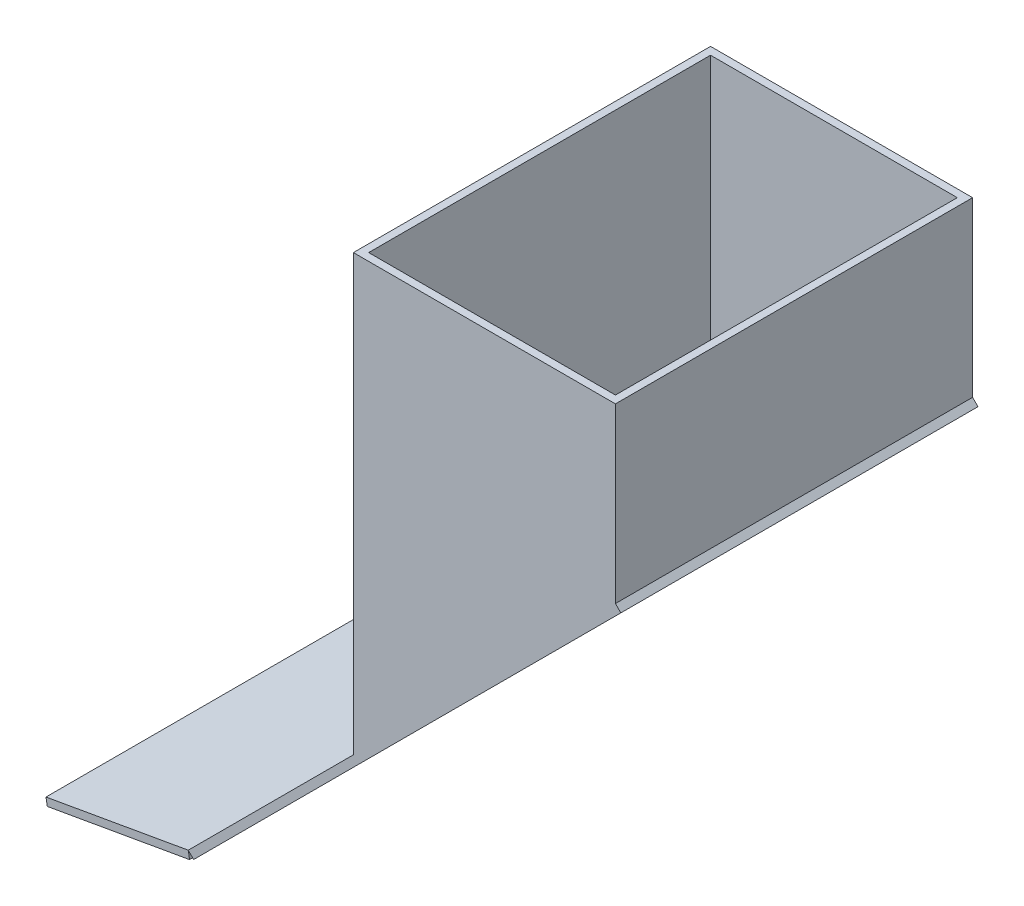
from build123d import *

# Parameters (mm, degrees)
BOSS_EXTRUDE1_REACH             = 773.931
SKETCH1_W                       = 217.7
SKETCH1_H                       = 296.7
SKETCH1_W_2                     = 205
SKETCH1_H_2                     = 284
SKETCH3_W                       = 296.7
SKETCH3_H                       = 501.874292529
BOSS_EXTRUDE2_DEPTH             = 6.35
CUT_EXTRUDE1_REACH              = 581.28
CUT_EXTRUDE1_DIRECTION_2_REACH  = 581.28
BOSS_EXTRUDE3_REACH             = 581.28
BOSS_EXTRUDE3_DIRECTION_2_REACH = 581.28
SKETCH6_W                       = 6.35
SKETCH6_H                       = 20
CUT_EXTRUDE2_DEPTH              = 22.5


with BuildPart() as part:
    # Boss-Extrude1: up to this plane
    boss_extrude1_end = Plane(origin=(126.25, -126.25, 0), z_dir=(-0.7071067811865488, 0.7071067811865464, 0))
    # Sketch1 → Boss-Extrude1 (new, up to the surface)
    with BuildSketch(Plane(origin=(0, 0, 0), x_dir=(1, 0, 0), z_dir=(0, 1, 0)), mode=Mode.PRIVATE) as boss_extrude1_sk1:
        Rectangle(SKETCH1_W, SKETCH1_H)
        Rectangle(SKETCH1_W_2, SKETCH1_H_2, mode=Mode.SUBTRACT)
    boss_extrude1_tool1 = split(extrude(boss_extrude1_sk1.sketch, amount=-BOSS_EXTRUDE1_REACH, mode=Mode.PRIVATE), bisect_by=boss_extrude1_end, keep=Keep.BOTH, mode=Mode.PRIVATE)
    add(boss_extrude1_tool1.solids().sort_by_distance((0, 0, -144.669998))[0])

    # Sketch3 → Boss-Extrude2 (add)
    with BuildSketch(Plane(origin=(126.25, -126.25, 0), x_dir=(0, 0, -1), z_dir=(-0.7071067811865488, 0.7071067811865464, 0))):
        with Locations((0, 275.54446225)):
            Rectangle(SKETCH3_W, SKETCH3_H)
    extrude(amount=-BOSS_EXTRUDE2_DEPTH)

    # Cut-Extrude1: up to this face of the body (flat: up to its plane)
    cut_extrude1_end = Plane(part.part.faces().sort_by_distance((-13.869636964, -133.184818482, -142))[0])
    # Sketch4 → Cut-Extrude1 (cut, up to the picked face)
    with BuildSketch(Plane.XY, mode=Mode.PRIVATE) as cut_extrude1_sk1:
        Polygon((-108.85, -361.35), (-102.5, -355), (-102.5, -293), (-108.85, -293), align=None)
    cut_extrude1_tool1 = split(extrude(cut_extrude1_sk1.sketch, amount=-CUT_EXTRUDE1_REACH, mode=Mode.PRIVATE), bisect_by=cut_extrude1_end, keep=Keep.BOTH, mode=Mode.PRIVATE)
    add(cut_extrude1_tool1.solids().sort_by(Axis((-105.726557, -325.613278, 0), (0, 0, -1)))[0], mode=Mode.SUBTRACT)

    # Cut-Extrude1 direction 2: up to this face of the body (flat: up to its plane)
    cut_extrude1_direction_2_end = Plane(part.part.faces().sort_by_distance((-13.869636964, -133.184818482, 142))[0])
    # Sketch4 → Cut-Extrude1 direction 2 (cut, up to the picked face)
    with BuildSketch(Plane.XY, mode=Mode.PRIVATE) as cut_extrude1_direction_2_sk1:
        Polygon((-108.85, -361.35), (-102.5, -355), (-102.5, -293), (-108.85, -293), align=None)
    cut_extrude1_direction_2_tool1 = split(extrude(cut_extrude1_direction_2_sk1.sketch, amount=CUT_EXTRUDE1_DIRECTION_2_REACH, mode=Mode.PRIVATE), bisect_by=cut_extrude1_direction_2_end, keep=Keep.BOTH, mode=Mode.PRIVATE)
    add(cut_extrude1_direction_2_tool1.solids().sort_by(Axis((-105.726557, -325.613278, 0), (0, 0, 1)))[0], mode=Mode.SUBTRACT)


with BuildPart() as body_2:

    # Boss-Extrude3: up to this face of the body (flat: up to its plane)
    boss_extrude3_end = Plane(part.part.faces().sort_by_distance((-18.419822897, -144.442148087, -148.35))[0])
    # Sketch5 → Boss-Extrude3 (new, up to the picked face)
    with BuildSketch(Plane.XY, mode=Mode.PRIVATE) as boss_extrude3_sk1:
        Polygon((-246.02871555, -498.52871555), (-244.926049622, -504.782244782), (-363.102979983, -525.620026102), (-364.205645912, -519.36649687), align=None)
    boss_extrude3_tool1 = split(extrude(boss_extrude3_sk1.sketch, amount=-BOSS_EXTRUDE3_REACH, mode=Mode.PRIVATE), bisect_by=boss_extrude3_end, keep=Keep.BOTH, mode=Mode.PRIVATE)
    add(boss_extrude3_tool1.solids().sort_by(Axis((-304.565848, -512.074371, 0), (0, 0, -1)))[0])


    # Boss-Extrude3 direction 2: up to this face of the body (flat: up to its plane)
    boss_extrude3_direction_2_end = Plane(part.part.faces().sort_by_distance((-18.419822897, -144.442148087, 148.35))[0])
    # Sketch5 → Boss-Extrude3 direction 2 (add, up to the picked face)
    with BuildSketch(Plane.XY, mode=Mode.PRIVATE) as boss_extrude3_direction_2_sk1:
        Polygon((-246.02871555, -498.52871555), (-244.926049622, -504.782244782), (-363.102979983, -525.620026102), (-364.205645912, -519.36649687), align=None)
    boss_extrude3_direction_2_tool1 = split(extrude(boss_extrude3_direction_2_sk1.sketch, amount=BOSS_EXTRUDE3_DIRECTION_2_REACH, mode=Mode.PRIVATE), bisect_by=boss_extrude3_direction_2_end, keep=Keep.BOTH, mode=Mode.PRIVATE)
    add(boss_extrude3_direction_2_tool1.solids().sort_by(Axis((-304.565848, -512.074371, 0), (0, 0, 1)))[0])


with BuildPart() as part_1:
    add(part.part)

    # Sketch6 → Cut-Extrude2 (cut, symmetric)
    with BuildSketch(Plane.XY):
        with Locations((-105.675, -259.5)):
            Rectangle(SKETCH6_W, SKETCH6_H)
        with Locations((-105.675, -216)):
            Rectangle(SKETCH6_W, SKETCH6_H)
    extrude(amount=CUT_EXTRUDE2_DEPTH, both=True, mode=Mode.SUBTRACT)


solid = Compound([body_2.part, part_1.part])
